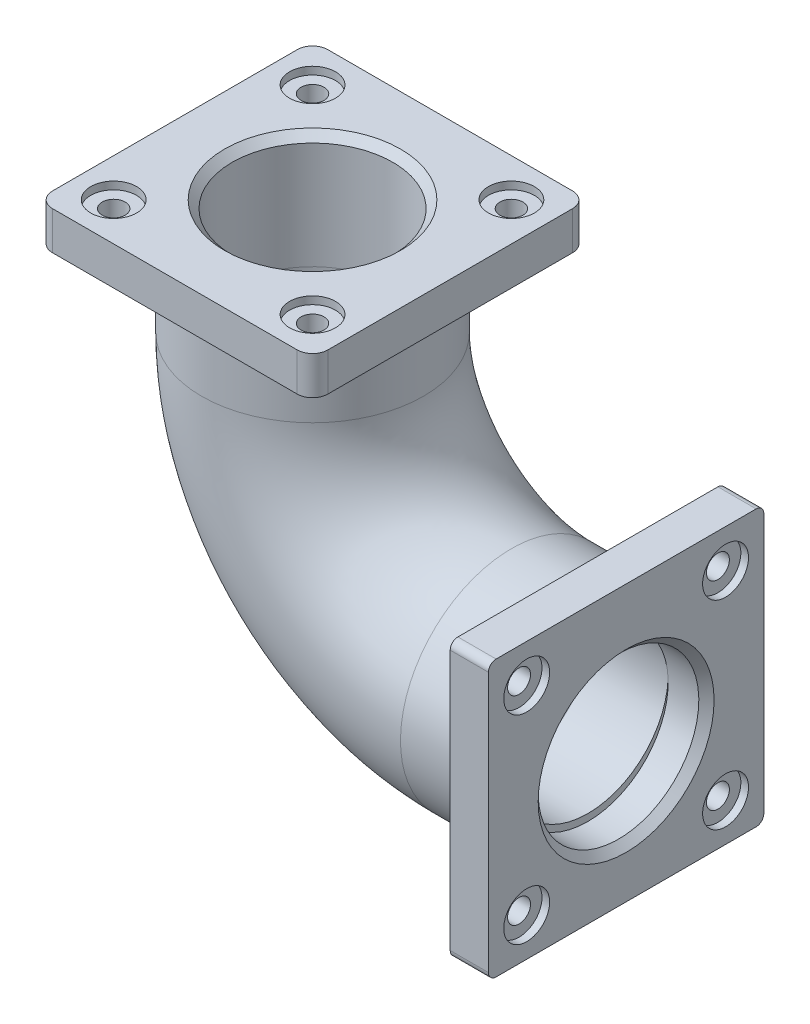
from build123d import *

# Parameters (mm, degrees)
SKETCH2_R           = 30
SKETCH2_R_2         = 105
SKETCH2_R_3         = 28.090856429
SKETCH2_R_4         = 15
BOSS_EXTRUDE2_DEPTH = 50
SKETCH5_R           = 30
CUT_EXTRUDE1_DEPTH  = 10
CHAMFER2_SIZE       = 10
BOSS_EXTRUDE3_START = 100
SKETCH6_R           = 145
SKETCH6_R_2         = 105
BOSS_EXTRUDE3_DEPTH = 100
CUT_EXTRUDE2_START  = -10
SKETCH9_R           = 30
SKETCH9_R_2         = 15
CUT_EXTRUDE2_DEPTH  = 10
SWEEP3_OUTLINE_R    = 145
SWEEP3_OUTLINE_R_2  = 105
SWEEP3_ANGLE        = 90
SKETCH12_R          = 145
SKETCH12_R_2        = 105
BOSS_EXTRUDE5_DEPTH = 100
BOSS_EXTRUDE6_DEPTH = 50
SKETCH14_R          = 105
CUT_EXTRUDE5_DEPTH  = 50
SKETCH17_R          = 30
SKETCH17_R_2        = 15
CUT_EXTRUDE6_DEPTH  = 10
SKETCH18_R          = 15
CUT_EXTRUDE7_DEPTH  = 100
CHAMFER3_SIZE       = 10


# Read off the part's stored shape, not the designer's step: Sweep3
with BuildPart() as part:
    # Sketch2 → Boss-Extrude2 (new body)
    # profile 1 of 5: a face of its own
    with BuildSketch(Plane(origin=(0, 0, 0), x_dir=(1, 0, 0), z_dir=(0, 1, 0))):
        with BuildLine():
            Line((-180, -130), (-180, -160))
            ThreePointArc((-180, -160), (-174.142135624, -174.142135624), (-160, -180))
            Line((-160, -180), (160, -180))
            ThreePointArc((160, -180), (174.142135624, -174.142135624), (180, -160))
            Line((180, -160), (180, 160))
            ThreePointArc((180, 160), (174.142135624, 174.142135624), (160, 180))
            Line((160, 180), (-160, 180))
            ThreePointArc((-160, 180), (-174.142135624, 174.142135624), (-180, 160))
            Line((-180, 160), (-180, -130))
        make_face()
        with Locations((-130, -130)):
            Circle(SKETCH2_R, mode=Mode.SUBTRACT)
        with Locations((130, -130)):
            Circle(SKETCH2_R, mode=Mode.SUBTRACT)
        with Locations((-130, 130)):
            Circle(SKETCH2_R, mode=Mode.SUBTRACT)
        with Locations(Location((0, 0, 0), (0, 0, 270))):
            Circle(SKETCH2_R_2, mode=Mode.SUBTRACT)
        with Locations((130, 130)):
            Circle(SKETCH2_R_3, mode=Mode.SUBTRACT)
    # profile 2 of 5: a face of its own
    with BuildSketch(Plane(origin=(0, 0, 0), x_dir=(1, 0, 0), z_dir=(0, 1, 0))):
        with Locations((-130, 130)):
            Circle(SKETCH2_R)
        with Locations(Location((-130, 130, 0), (0, 0, 270))):
            Circle(SKETCH2_R_4, mode=Mode.SUBTRACT)
    # profile 3 of 5: a face of its own
    with BuildSketch(Plane(origin=(0, 0, 0), x_dir=(1, 0, 0), z_dir=(0, 1, 0))):
        with Locations((130, 130)):
            Circle(SKETCH2_R_3)
        with Locations(Location((130, 130, 0), (0, 0, 270))):
            Circle(SKETCH2_R_4, mode=Mode.SUBTRACT)
    # profile 4 of 5: a face of its own
    with BuildSketch(Plane(origin=(0, 0, 0), x_dir=(1, 0, 0), z_dir=(0, 1, 0))):
        with Locations((-130, -130)):
            Circle(SKETCH2_R)
        with Locations(Location((-130, -130, 0), (0, 0, 270))):
            Circle(SKETCH2_R_4, mode=Mode.SUBTRACT)
    # profile 5 of 5: a face of its own
    with BuildSketch(Plane(origin=(0, 0, 0), x_dir=(1, 0, 0), z_dir=(0, 1, 0))):
        with Locations((130, -130)):
            Circle(SKETCH2_R)
        with Locations(Location((130, -130, 0), (0, 0, 270))):
            Circle(SKETCH2_R_4, mode=Mode.SUBTRACT)
    extrude(amount=BOSS_EXTRUDE2_DEPTH)

    # Sketch5 → Cut-Extrude1 (cut)
    with BuildSketch(Plane(origin=(0, 50, 0), x_dir=(1, 0, 0), z_dir=(0, 1, 0))):
        with Locations(Location((-130, 130, 0), (0, 0, 270))):
            Circle(SKETCH5_R)
        with Locations(Location((130, 130, 0), (0, 0, 270))):
            Circle(SKETCH5_R)
        with Locations(Location((-130, -130, 0), (0, 0, 270))):
            Circle(SKETCH5_R)
    extrude(amount=-CUT_EXTRUDE1_DEPTH, mode=Mode.SUBTRACT)

    # Chamfer2
    chamfer2_edges = [part.edges().sort_by_distance(p)[0] for p in [
        (0, 50, -105),
    ]]
    chamfer(chamfer2_edges, length=CHAMFER2_SIZE)

    # Sketch6 → Boss-Extrude3 (add)
    with BuildSketch(Plane.XZ.offset(BOSS_EXTRUDE3_START)):
        with Locations(Location((0, 0, 0), (0, 0, 90))):
            Circle(SKETCH6_R)
        with Locations(Location((0, 0, 0), (0, 0, 270))):
            Circle(SKETCH6_R_2, mode=Mode.SUBTRACT)
    extrude(amount=-BOSS_EXTRUDE3_DEPTH)

    # Sketch9 → Cut-Extrude2 (cut)
    with BuildSketch(Plane(origin=(0, 50, 0), x_dir=(1, 0, 0), z_dir=(0, 1, 0)).offset(CUT_EXTRUDE2_START)):
        with Locations(Location((130, -130, 0), (0, 0, 270))):
            Circle(SKETCH9_R)
        with Locations(Location((130, -130, 0), (0, 0, 270))):
            Circle(SKETCH9_R_2, mode=Mode.SUBTRACT)
    extrude(amount=CUT_EXTRUDE2_DEPTH, mode=Mode.SUBTRACT)

    # Sweep3 outline → Sweep3 (revolve)
    with BuildSketch(Plane(origin=(260, -100, 0), x_dir=(-1, 0, 0), z_dir=(0, 1, 0))):
        with Locations((260, 0)):
            Circle(SWEEP3_OUTLINE_R)
        with Locations((260, 0)):
            Circle(SWEEP3_OUTLINE_R_2, mode=Mode.SUBTRACT)
    revolve(axis=Axis((260, -100, 0), (0, 0, 1)), revolution_arc=SWEEP3_ANGLE)

    # Sketch12 → Boss-Extrude5 (add)
    with BuildSketch(Plane(origin=(260, 0, 0), x_dir=(0, 0, -1), z_dir=(1, 0, 0))):
        with Locations(Location((0, -360, 0), (0, 0, 270))):
            Circle(SKETCH12_R)
        with Locations(Location((0, -360, 0), (0, 0, 270))):
            Circle(SKETCH12_R_2, mode=Mode.SUBTRACT)
    extrude(amount=BOSS_EXTRUDE5_DEPTH)

    # Sketch13 → Boss-Extrude6 (add)
    with BuildSketch(Plane(origin=(360, 0, 0), x_dir=(0, 0, -1), z_dir=(1, 0, 0))):
        with BuildLine():
            Line((-170, -540), (170, -540))
            ThreePointArc((170, -540), (177.071067812, -537.071067812), (180, -530))
            Line((180, -530), (180, -190))
            ThreePointArc((180, -190), (177.071067812, -182.928932188), (170, -180))
            Line((170, -180), (-170, -180))
            ThreePointArc((-170, -180), (-177.071067812, -182.928932188), (-180, -190))
            Line((-180, -190), (-180, -530))
            ThreePointArc((-180, -530), (-177.071067812, -537.071067812), (-170, -540))
        make_face()
    extrude(amount=BOSS_EXTRUDE6_DEPTH)

    # Sketch14 → Cut-Extrude5 (cut)
    with BuildSketch(Plane(origin=(410, 0, 0), x_dir=(0, 0, -1), z_dir=(1, 0, 0))):
        with Locations(Location((0, -369.029004143, 0), (0, 0, 90))):
            Circle(SKETCH14_R)
    extrude(amount=-CUT_EXTRUDE5_DEPTH, mode=Mode.SUBTRACT)

    # Sketch17 → Cut-Extrude6 (cut)
    # profile 1 of 4: a face of its own
    with BuildSketch(Plane(origin=(410, 0, 0), x_dir=(0, 0, -1), z_dir=(1, 0, 0))):
        with Locations(Location((-130, -230, 0), (0, 0, 90))):
            Circle(SKETCH17_R)
        with Locations(Location((-130, -230, 0), (0, 0, 90))):
            Circle(SKETCH17_R_2, mode=Mode.SUBTRACT)
    # profile 2 of 4: a face of its own
    with BuildSketch(Plane(origin=(410, 0, 0), x_dir=(0, 0, -1), z_dir=(1, 0, 0))):
        with Locations(Location((-130, -490, 0), (0, 0, 90))):
            Circle(SKETCH17_R)
        with Locations(Location((-130, -490, 0), (0, 0, 90))):
            Circle(SKETCH17_R_2, mode=Mode.SUBTRACT)
    # profile 3 of 4: a face of its own
    with BuildSketch(Plane(origin=(410, 0, 0), x_dir=(0, 0, -1), z_dir=(1, 0, 0))):
        with Locations(Location((130, -490, 0), (0, 0, 90))):
            Circle(SKETCH17_R)
        with Locations(Location((130, -490, 0), (0, 0, 90))):
            Circle(SKETCH17_R_2, mode=Mode.SUBTRACT)
    # profile 4 of 4: a face of its own
    with BuildSketch(Plane(origin=(410, 0, 0), x_dir=(0, 0, -1), z_dir=(1, 0, 0))):
        with Locations(Location((130, -230, 0), (0, 0, 90))):
            Circle(SKETCH17_R)
        with Locations(Location((130, -230, 0), (0, 0, 90))):
            Circle(SKETCH17_R_2, mode=Mode.SUBTRACT)
    extrude(amount=-CUT_EXTRUDE6_DEPTH, mode=Mode.SUBTRACT)

    # Sketch18 → Cut-Extrude7 (cut)
    with BuildSketch(Plane(origin=(410, 0, 0), x_dir=(0, 0, -1), z_dir=(1, 0, 0))):
        with Locations(Location((-130, -230, 0), (0, 0, 90))):
            Circle(SKETCH18_R)
        with Locations(Location((130, -230, 0), (0, 0, 90))):
            Circle(SKETCH18_R)
        with Locations(Location((-130, -490, 0), (0, 0, 90))):
            Circle(SKETCH18_R)
        with Locations(Location((130, -490, 0), (0, 0, 90))):
            Circle(SKETCH18_R)
    extrude(amount=-CUT_EXTRUDE7_DEPTH, mode=Mode.SUBTRACT)

    # Chamfer3
    chamfer3_edges = [part.edges().sort_by_distance(p)[0] for p in [
        (410, -474.029004143, 0),
    ]]
    chamfer(chamfer3_edges, length=CHAMFER3_SIZE)


solid = part.part
